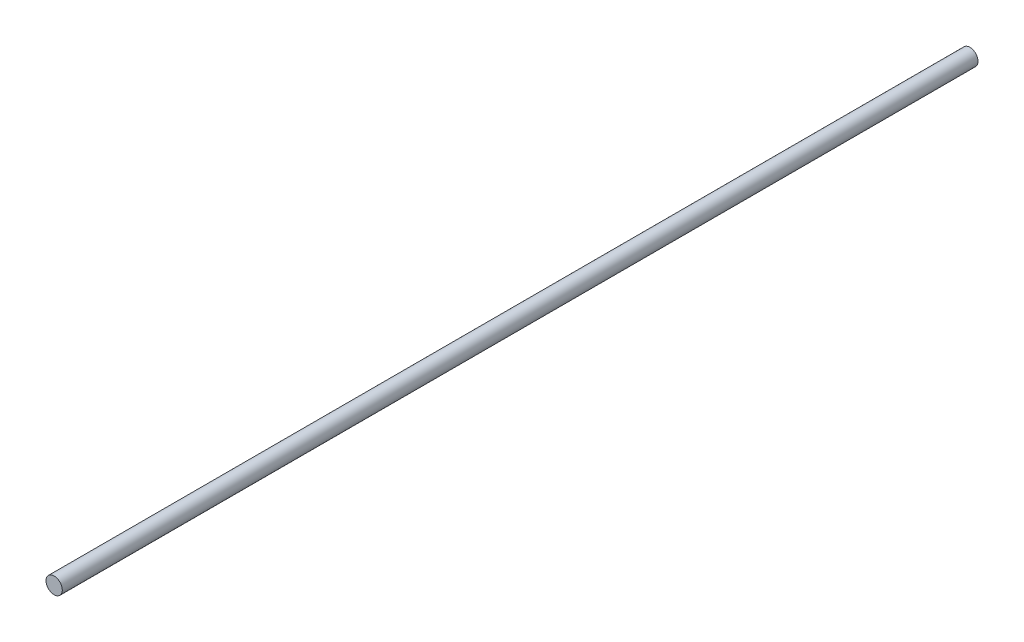
from build123d import *

# Parameters (mm, degrees)
SKETCH1_R           = 4
BOSS_EXTRUDE1_DEPTH = 450


with BuildPart() as part:
    # Sketch1 → Boss-Extrude1 (new body)
    with BuildSketch(Plane.XY):
        with Locations((-6.92426235, 1.80200632)):
            Circle(SKETCH1_R)
    extrude(amount=BOSS_EXTRUDE1_DEPTH)


solid = part.part
